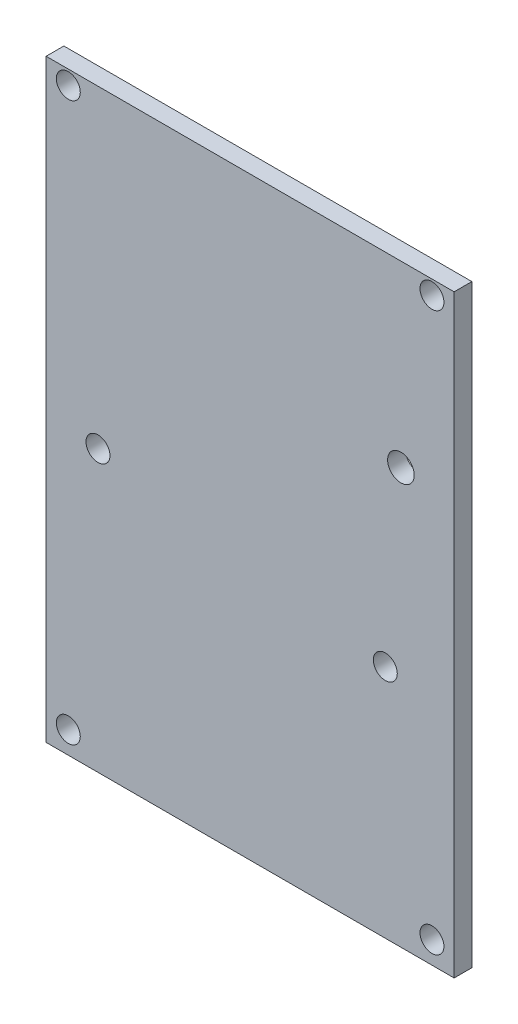
from build123d import *

# Parameters (mm, degrees)
SKETCH1_W                  = 46
SKETCH1_H                  = 67
BOSS_EXTRUDE1_DEPTH        = 2
F_2_7_2_7_DIAMETER_HOLE1_D = 2.7
F_3_0_3_DIAMETER_HOLE1_D   = 3


with BuildPart() as part:
    # Sketch1 → Boss-Extrude1 (new body)
    with BuildSketch(Plane.XY):
        Rectangle(SKETCH1_W, SKETCH1_H)
    extrude(amount=BOSS_EXTRUDE1_DEPTH)

    # Ø2.7 (2.7) Diameter Hole1 (through all)
    with Locations(Plane.XY.offset(2)):
        with Locations((-20.5, 31.9), (20.5, 31.9), (20.5, -31), (-20.5, -31), (-17.155, -1.895), (15.24, -6.985)):
            Hole(F_2_7_2_7_DIAMETER_HOLE1_D / 2)

    # Ø3.0 (3) Diameter Hole1 (through all)
    with Locations(Plane.XY.offset(2)):
        with Locations((17, 13.345)):
            Hole(F_3_0_3_DIAMETER_HOLE1_D / 2)


solid = part.part
